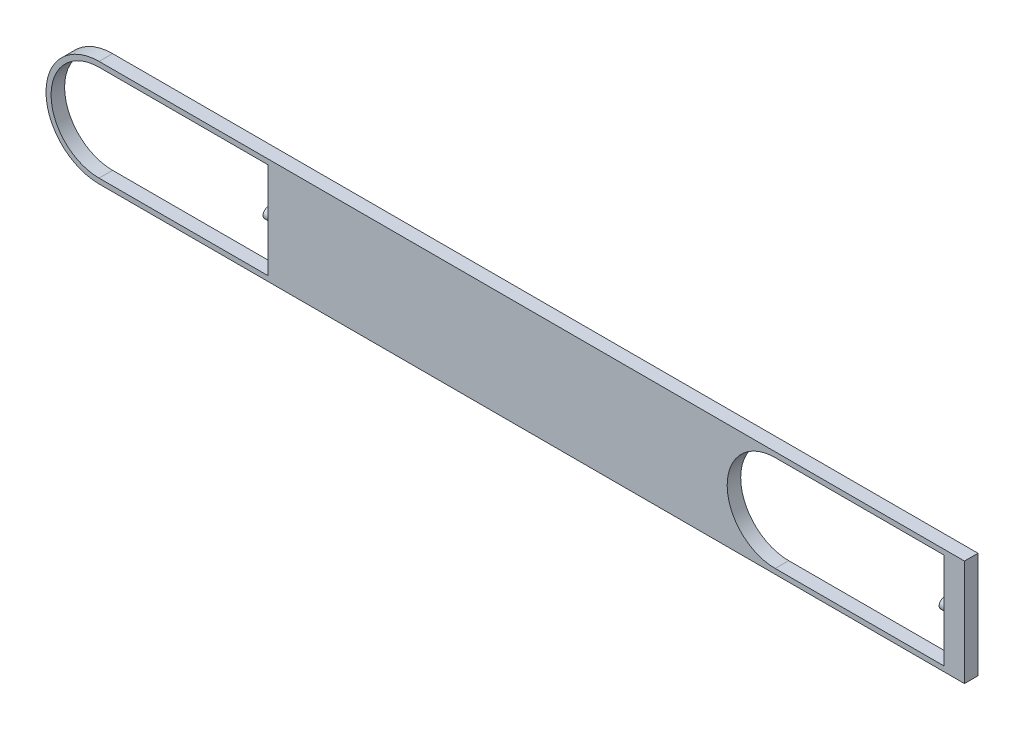
from build123d import *

# Parameters (mm, degrees)
SKETCH1_R                = 19.939
CIRCLE_EXTRUDE_DEPTH     = 5.08
SKETCH3_W                = 5.08
SKETCH3_H                = 39.878
RECTANGLE_EXTRUDE_DEPTH  = 127
SKETCH2_R                = 18.034
CIRCLE_CUT_DEPTH         = 129.65601471
SKETCH6_W                = 125.095
SKETCH6_H                = 36.068
RECTANGLE_CUT_DEPTH      = 129.65601471
SKETCH7_W                = 61.595
SKETCH7_H                = 36.068
END_SHAPE_DEPTH          = 5.08
SKETCH8_R                = 1.905
FOR_SPRING_EXTRUDE_DEPTH = 2.54
MIRRORED_PATTERN_COUNT   = 2
MIRRORED_PATTERN_PITCH   = 254
MIDDLE_CONNECTOR_REACH   = 256.832
SKETCH10_W               = 5.08
SKETCH10_H               = 39.878
SKETCH11_W               = 5.08
SKETCH11_H               = 39.878
END_CUT_DEPTH            = 55.88


with BuildPart() as part:
    # Sketch1 → circle extrude (new body)
    with BuildSketch(Plane.XY):
        Circle(SKETCH1_R)
    extrude(amount=CIRCLE_EXTRUDE_DEPTH)

    # Sketch3 → rectangle extrude (add)
    with BuildSketch(Plane(origin=(0, 0, 0), x_dir=(0, 0, -1), z_dir=(1, 0, 0))):
        with Locations((-2.54, 0)):
            Rectangle(SKETCH3_W, SKETCH3_H)
    extrude(amount=RECTANGLE_EXTRUDE_DEPTH)

    # Sketch2 → circle cut (cut, through all)
    with BuildSketch(Plane.XY.offset(5.08)):
        Circle(SKETCH2_R)
    extrude(amount=-CIRCLE_CUT_DEPTH, mode=Mode.SUBTRACT)

    # Sketch6 → rectangle cut (cut, through all)
    with BuildSketch(Plane.XY.offset(5.08)):
        with Locations((62.5475, 0)):
            Rectangle(SKETCH6_W, SKETCH6_H)
    extrude(amount=-RECTANGLE_CUT_DEPTH, mode=Mode.SUBTRACT)

    # Sketch7 → end shape (add)
    with BuildSketch(Plane.XY.offset(5.08)):
        with Locations((94.2975, 0)):
            Rectangle(SKETCH7_W, SKETCH7_H)
    extrude(amount=-END_SHAPE_DEPTH)

    # Sketch8 → for spring extrude (add)
    with BuildSketch(Plane.ZY.offset(-63.5)):
        with Locations((2.54, 0)):
            Circle(SKETCH8_R)
    extrude(amount=FOR_SPRING_EXTRUDE_DEPTH)


with BuildPart() as mirrored_pattern_1:
    # mirrored pattern: pattern copy
    add(part.part.moved(Location(Vector(1, 0, 0) * (1 * MIRRORED_PATTERN_PITCH))))

    # Sketch10 → middle connector (add, up to next)
    with BuildSketch(Plane(origin=(127, 0, 0), x_dir=(0, 0, -1), z_dir=(1, 0, 0)), mode=Mode.PRIVATE) as middle_connector_sk1:
        with Locations((-2.54, 0)):
            Rectangle(SKETCH10_W, SKETCH10_H)
    middle_connector_tool1 = extrude(middle_connector_sk1.sketch, amount=MIDDLE_CONNECTOR_REACH, mode=Mode.PRIVATE) - mirrored_pattern_1.part

    add(part.part)  # middle connector merges part
    add(middle_connector_tool1.solids().sort_by_distance((127, 0, 2.54))[0])

    # Sketch11 → end cut (cut)
    with BuildSketch(Plane(origin=(381, 0, 0), x_dir=(0, 0, -1), z_dir=(1, 0, 0))):
        with Locations((-2.54, 0)):
            Rectangle(SKETCH11_W, SKETCH11_H)
    extrude(amount=-END_CUT_DEPTH, mode=Mode.SUBTRACT)


solid = mirrored_pattern_1.part
